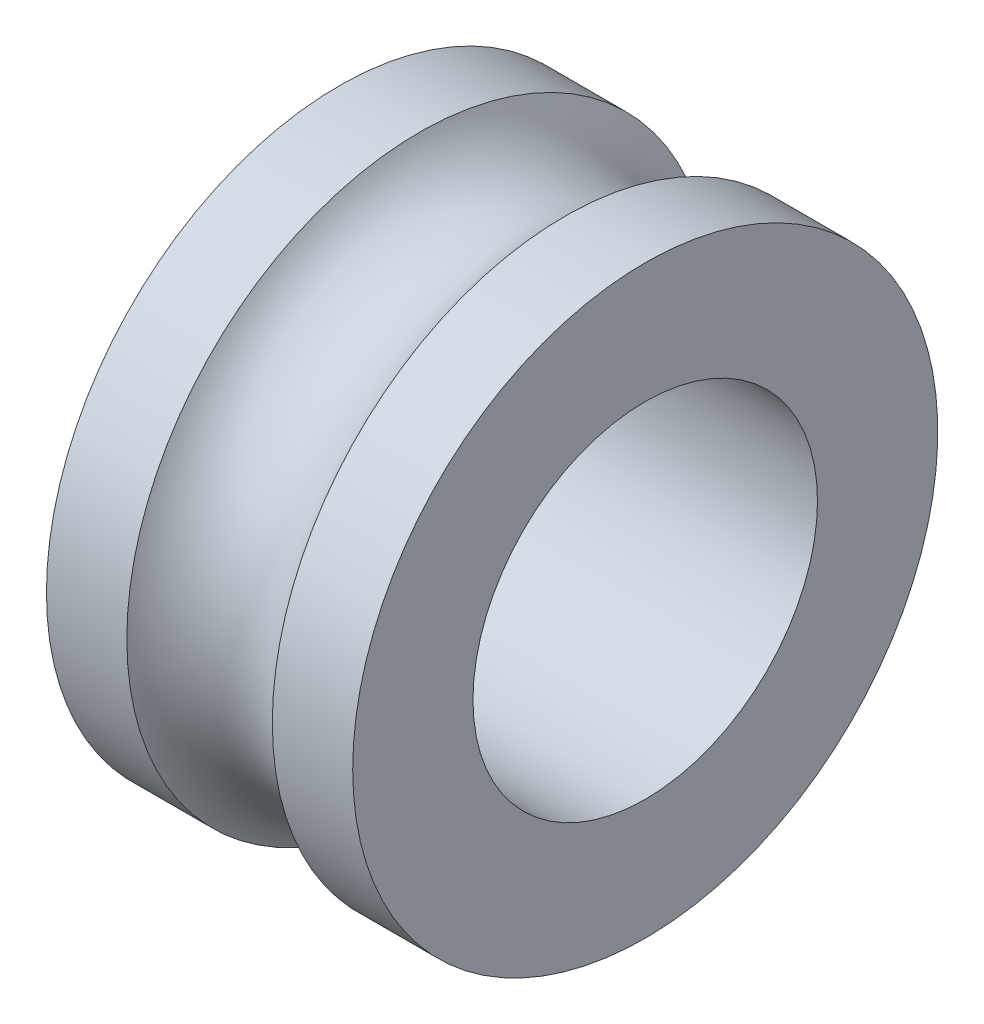
from build123d import *


with BuildPart() as part:
    # Sketch1 → Revolve1 (revolve)
    with BuildSketch(Plane.XY):
        with BuildLine():
            Line((0, 0), (4, 0))
            Line((4, 0), (4, 3.142))
            Line((4, 3.142), (1.9, 3.142))
            ThreePointArc((1.9, 3.142), (0, 2.051053651), (-1.9, 3.142))
            Line((-1.9, 3.142), (-4, 3.142))
            Line((-4, 3.142), (-4, 0))
            Line((-4, 0), (0, 0))
        make_face()
    revolve(axis=Axis((-4, -4.5, 0), (1, 0, 0)))


solid = part.part
